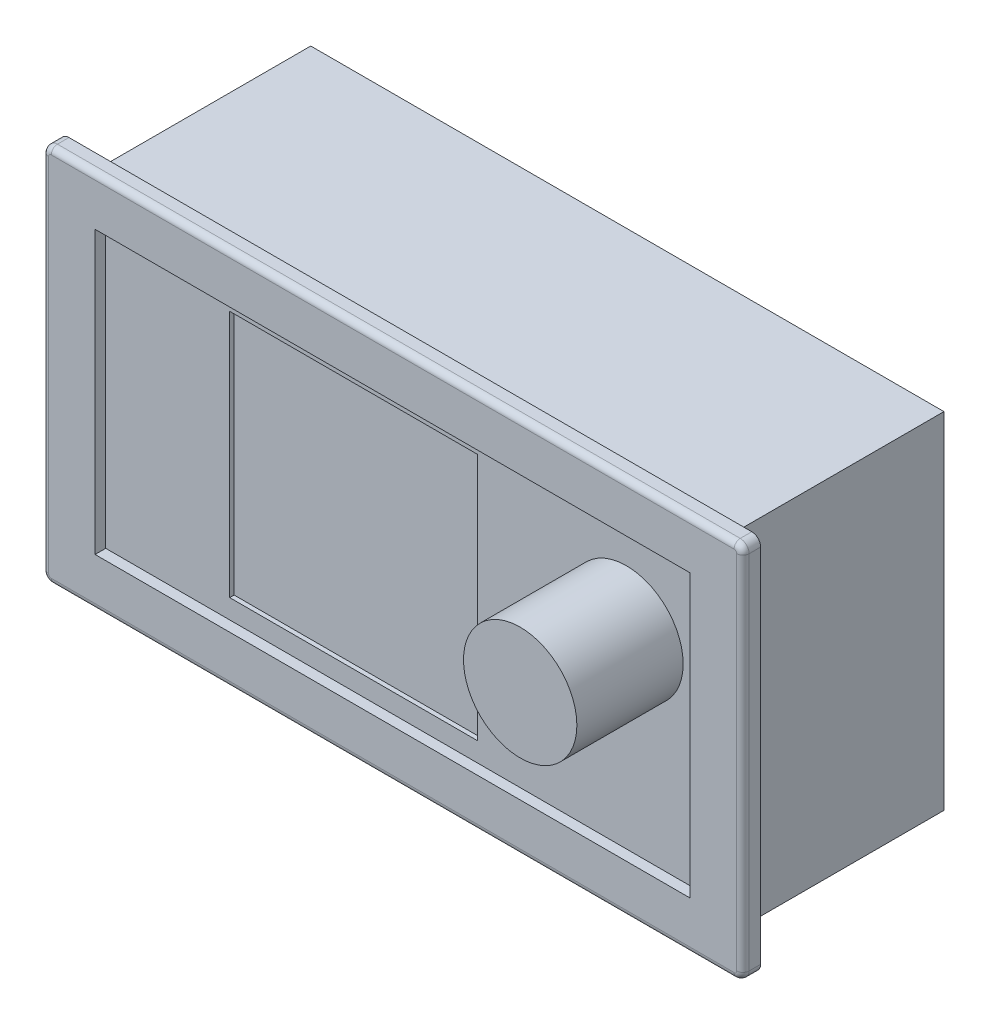
from build123d import *

# Parameters (mm, degrees)
SKETCH_1_W          = 71.5
SKETCH_1_H          = 39
EXTRUDE_1_DEPTH     = 24.5
SKETCH_2_W          = 79.1
SKETCH_2_H          = 42.8
EXTRUDE_2_DEPTH     = 2
FILLET_1_R          = 0.7
FILLET_2_R          = 1
SKETCH_3_W          = 67.2
SKETCH_3_H          = 31.8
CUT_EXTRUDE_1_DEPTH = 1.2
SKETCH_4_R          = 6.4
EXTRUDE_3_DEPTH     = 12
SKETCH_5_W          = 28
SKETCH_5_H          = 28
CUT_EXTRUDE_2_DEPTH = 0.5


with BuildPart() as part:
    # Эскиз1 → Бобышка-Вытянуть1 (new body)
    with BuildSketch(Plane.XY):
        Rectangle(SKETCH_1_W, SKETCH_1_H)
    extrude(amount=EXTRUDE_1_DEPTH)

    # Эскиз2 → Бобышка-Вытянуть2 (add)
    with BuildSketch(Plane.XY.offset(24.5)):
        Rectangle(SKETCH_2_W, SKETCH_2_H)
    extrude(amount=EXTRUDE_2_DEPTH)

    # Скругление1
    fillet_1_edges = [part.edges().sort_by_distance(p)[0] for p in [
        (39.55, 0, 26.5),
        (0, 21.4, 26.5),
        (-39.55, 0, 26.5),
        (0, -21.4, 26.5),
    ]]
    fillet(fillet_1_edges, radius=FILLET_1_R)

    # Скругление2
    # the kernel refuses this fillet: 1 mm, written as the material it takes off along each edge
    with BuildSketch(Plane(origin=(-38.55, 20.4, 26.5), x_dir=(0, 1, 0), z_dir=(1, 0, 0))) as fillet_2_piece_1:
        with BuildLine():
            CenterArc((0.3, -0.7), 0.7, 0, 90)
            Line((1, -0.7), (1, 0))
            Line((1, 0), (0.3, 0))
        make_face()
    revolve(axis=Axis((-38.55, 20.4, 26.5), (0, 0, 1)), revolution_arc=90, mode=Mode.SUBTRACT)
    with BuildSketch(Plane(origin=(38.55, 20.4, 26.5), x_dir=(1, 0, 0), z_dir=(0, -1, 0))) as fillet_2_piece_2:
        with BuildLine():
            CenterArc((0.3, -0.7), 0.7, 0, 90)
            Line((1, -0.7), (1, 0))
            Line((1, 0), (0.3, 0))
        make_face()
    revolve(axis=Axis((38.55, 20.4, 26.5), (0, 0, 1)), revolution_arc=90, mode=Mode.SUBTRACT)
    with BuildSketch(Plane(origin=(-38.55, -20.4, 26.5), x_dir=(-1, 0, 0), z_dir=(0, 1, 0))) as fillet_2_piece_3:
        with BuildLine():
            CenterArc((0.3, -0.7), 0.7, 0, 90)
            Line((1, -0.7), (1, 0))
            Line((1, 0), (0.3, 0))
        make_face()
    revolve(axis=Axis((-38.55, -20.4, 26.5), (0, 0, 1)), revolution_arc=90, mode=Mode.SUBTRACT)
    with BuildSketch(Plane(origin=(38.55, -20.4, 26.5), x_dir=(0, -1, 0), z_dir=(-1, 0, 0))) as fillet_2_piece_4:
        with BuildLine():
            CenterArc((0.3, -0.7), 0.7, 0, 90)
            Line((1, -0.7), (1, 0))
            Line((1, 0), (0.3, 0))
        make_face()
    revolve(axis=Axis((38.55, -20.4, 26.5), (0, 0, 1)), revolution_arc=90, mode=Mode.SUBTRACT)
    with BuildSketch(Plane(origin=(39.55, -21.4, 22), x_dir=(0, 1, 0), z_dir=(0, 0, 1)), Plane(origin=(39.55, 21.4, 22), x_dir=(-1, 0, 0), z_dir=(0, 0, 1))) as fillet_2_piece_5:
        with BuildLine():
            CenterArc((FILLET_2_R, FILLET_2_R), FILLET_2_R, 180, 90)
            Line((0, FILLET_2_R), (0, 0))
            Line((0, 0), (FILLET_2_R, 0))
        make_face()
    extrude(amount=4.5, mode=Mode.SUBTRACT)
    with BuildSketch(Plane(origin=(-39.55, -21.4, 22), x_dir=(0, 1, 0), z_dir=(0, 0, 1)), Plane(origin=(-39.55, 21.4, 22), x_dir=(1, 0, 0), z_dir=(0, 0, 1))) as fillet_2_piece_6:
        with BuildLine():
            CenterArc((FILLET_2_R, -FILLET_2_R), FILLET_2_R, 90, 90)
            Line((0, -FILLET_2_R), (0, 0))
            Line((0, 0), (FILLET_2_R, 0))
        make_face()
    extrude(amount=4.5, mode=Mode.SUBTRACT)

    # Эскиз3 → Вырез-Вытянуть1 (cut)
    with BuildSketch(Plane.XY.offset(26.5)):
        Rectangle(SKETCH_3_W, SKETCH_3_H)
    extrude(amount=-CUT_EXTRUDE_1_DEPTH, mode=Mode.SUBTRACT)

    # Эскиз4 → Бобышка-Вытянуть3 (add)
    with BuildSketch(Plane.XY.offset(25.3)):
        with Locations((25.2, 5.4)):
            Circle(SKETCH_4_R)
    extrude(amount=EXTRUDE_3_DEPTH)

    # Эскиз5 → Вырез-Вытянуть2 (cut)
    with BuildSketch(Plane.XY.offset(25.3)):
        with Locations((-5.6, 0.282517759)):
            Rectangle(SKETCH_5_W, SKETCH_5_H)
    extrude(amount=-CUT_EXTRUDE_2_DEPTH, mode=Mode.SUBTRACT)


solid = part.part
